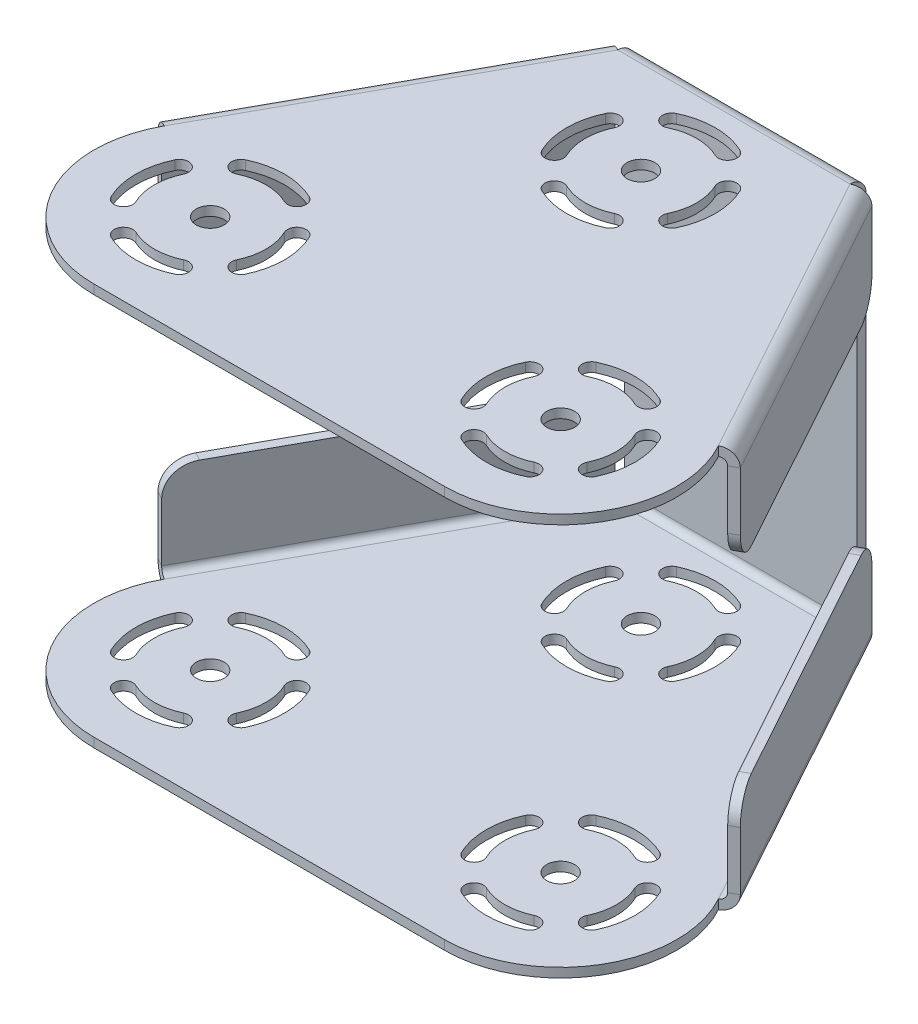
from build123d import *

# Parameters (mm, degrees)
SM_BASE_FLANGE_1_DEPTH        = 1
SM_EDGE_FLANGE_1_DEPTH        = 25
SM_EDGE_FLANGE_2_DEPTH        = 25
SM_START                      = 1
SM_EDGE_FLANGE_2_FLAT_DEPTH   = 1
SKETCH_6_R                    = 1.5
CUT_EXTRUDE_1_DEPTH           = 79.396934628
FILLET_1_R                    = 12.5
SM_EDGE_FLANGE_3_DEPTH        = 35.922670789
SM_EDGE_FLANGE_3_BEND_DEPTH   = 35.922670789
SM_EDGE_FLANGE_3_BEND_2_DEPTH = 35.922670789
SM_EDGE_FLANGE_3_BEND_3_DEPTH = 35.922670789
FILLET_2_R                    = 3
SKETCH_36_R                   = 1.5
CUT_EXTRUDE_2_DEPTH           = 75.360427128


# Sheet-metal steps are written as plain solids
with BuildPart() as part:
    # Sketch 1 → 基材-凸緣1 (new body)
    with BuildSketch(Plane(origin=(0, 0, 0), x_dir=(1, 0, 0), z_dir=(0, 1, 0))):
        Polygon((-12.5, 50), (-40, 0), (40, 0), (12.5, 50), align=None)
    extrude(amount=-SM_BASE_FLANGE_1_DEPTH)

    # 邊線-凸緣1 section (across the edge) → 邊線-凸緣1 (add)
    with BuildSketch(Plane(origin=(-12.5, -1, -50.7366), x_dir=(0, 0, 1), z_dir=(1, 0, 0))):
        with BuildLine():
            Line((-1, 0.7366), (-1, 40.5))
            Line((-1, 40.5), (0, 40.5))
            Line((0, 40.5), (0, 0.7366))
            ThreePointArc((0, 0.7366), (0.215745145, 0.215745145), (0.7366, 0))
            Line((0.7366, 0), (0.7366, -1))
            ThreePointArc((0.7366, -1), (-0.491361636, -0.491361636), (-1, 0.7366))
        make_face()
    extrude(amount=SM_EDGE_FLANGE_1_DEPTH)

    # 邊線-凸緣2 bend section (across the edge) → 邊線-凸緣2 (add)
    with BuildSketch(Plane(origin=(-12.5, -42.2366, -50.7366), x_dir=(0, 1, 0), z_dir=(1, 0, 0))):
        with BuildLine():
            Line((-1, 0.7366), (0, 0.7366))
            ThreePointArc((0, 0.7366), (0.215745145, 0.215745145), (0.7366, 0))
            Line((0.7366, 0), (0.7366, -1))
            ThreePointArc((0.7366, -1), (-0.491361636, -0.491361636), (-1, 0.7366))
        make_face()
    extrude(amount=SM_EDGE_FLANGE_2_DEPTH)

    # 邊線-凸緣2 profile (on flange) → 邊線-凸緣2 flat (add)
    with BuildSketch(Plane(origin=(0, -42.2366, -50.7366), x_dir=(1, 0, 0), z_dir=(0, -1, 0)).offset(SM_START)):
        Polygon((12.5, 0.7366), (40, 50.7366), (-40, 50.7366), (-12.5, 0.7366), align=None)
    extrude(amount=-SM_EDGE_FLANGE_2_FLAT_DEPTH)

    # Sketch 6 → 除料-伸長1 (cut, through all)
    with BuildSketch(Plane(origin=(0, 0, 0), x_dir=(1, 0, 0), z_dir=(0, 1, 0))):
        with Locations(Location((0, 40, 0), (0, 0, 270))):
            Circle(SKETCH_6_R)
        with BuildLine():
            ThreePointArc((3.428571429, 47.228063223), (0, 48), (-3.428571429, 47.228063223))
            ThreePointArc((-3.428571429, 47.228063223), (-3.903507903, 45.895983892), (-2.571428571, 45.421047417))
            ThreePointArc((-2.571428571, 45.421047417), (0, 46), (2.571428571, 45.421047417))
            ThreePointArc((2.571428571, 45.421047417), (3.903507903, 45.895983892), (3.428571429, 47.228063223))
        make_face()
        with BuildLine():
            ThreePointArc((-5.421047417, 42.571428571), (-6, 40), (-5.421047417, 37.428571429))
            ThreePointArc((-5.421047417, 37.428571429), (-5.895983892, 36.096492097), (-7.228063223, 36.571428571))
            ThreePointArc((-7.228063223, 36.571428571), (-8, 40), (-7.228063223, 43.428571429))
            ThreePointArc((-7.228063223, 43.428571429), (-5.895983892, 43.903507903), (-5.421047417, 42.571428571))
        make_face()
        with BuildLine():
            ThreePointArc((-2.571428571, 34.578952583), (0, 34), (2.571428571, 34.578952583))
            ThreePointArc((2.571428571, 34.578952583), (3.903507903, 34.104016108), (3.428571429, 32.771936777))
            ThreePointArc((3.428571429, 32.771936777), (0, 32), (-3.428571429, 32.771936777))
            ThreePointArc((-3.428571429, 32.771936777), (-3.903507903, 34.104016108), (-2.571428571, 34.578952583))
        make_face()
        with BuildLine():
            ThreePointArc((5.421047417, 37.428571429), (6, 40), (5.421047417, 42.571428571))
            ThreePointArc((5.421047417, 42.571428571), (5.895983892, 43.903507903), (7.228063223, 43.428571429))
            ThreePointArc((7.228063223, 43.428571429), (8, 40), (7.228063223, 36.571428571))
            ThreePointArc((7.228063223, 36.571428571), (5.895983892, 36.096492097), (5.421047417, 37.428571429))
        make_face()
    extrude(amount=-CUT_EXTRUDE_1_DEPTH, mode=Mode.SUBTRACT)

    # 圓角1
    fillet_1_edges = [part.edges().sort_by_distance(p)[0] for p in [
        (40, -42.7366, 0),
        (-40, -42.7366, 0),
        (40, -0.5, 0),
        (-40, -0.5, 0),
    ]]
    fillet(fillet_1_edges, radius=FILLET_1_R)

    # 邊線-凸緣3 section (across the edge) → 邊線-凸緣3 (add)
    with BuildSketch(Plane(origin=(-13.145420638, -42.2366, -50.354981351), x_dir=(0.8762159086766461, -1.0482730393447964e-15, 0.48191874977215743), z_dir=(-0.48191874977215743, -8.305964765733612e-15, 0.8762159086766461))):
        with BuildLine():
            Line((-1, 0.7366), (-1, 10))
            Line((-1, 10), (0, 10))
            Line((0, 10), (0, 0.7366))
            ThreePointArc((0, 0.7366), (0.215745145, 0.215745145), (0.7366, 0))
            Line((0.7366, 0), (0.7366, -1))
            ThreePointArc((0.7366, -1), (-0.491361636, -0.491361636), (-1, 0.7366))
        make_face()
    extrude(amount=SM_EDGE_FLANGE_3_DEPTH)

    # 邊線-凸緣3 section 2 (across the edge) → 邊線-凸緣3 bend (add)
    with BuildSketch(Plane(origin=(-30.457229234, -1, -18.878965723), x_dir=(0.8762159086766471, -3.491481338843133e-15, 0.4819187497721558), z_dir=(0.4819187497721558, 0, -0.8762159086766471))):
        with BuildLine():
            Line((-1, 0.7366), (-1, 10))
            Line((-1, 10), (0, 10))
            Line((0, 10), (0, 0.7366))
            ThreePointArc((0, 0.7366), (0.215745145, 0.215745145), (0.7366, 0))
            Line((0.7366, 0), (0.7366, -1))
            ThreePointArc((0.7366, -1), (-0.491361636, -0.491361636), (-1, 0.7366))
        make_face()
    extrude(amount=SM_EDGE_FLANGE_3_BEND_DEPTH)

    # 邊線-凸緣3 section 3 (across the edge) → 邊線-凸緣3 bend 2 (add)
    with BuildSketch(Plane(origin=(13.145420638, -1, -50.354981351), x_dir=(-0.8762159086766472, -3.4914813388431337e-15, 0.48191874977215576), z_dir=(0.48191874977215576, 0, 0.8762159086766472))):
        with BuildLine():
            Line((-1, 0.7366), (-1, 10))
            Line((-1, 10), (0, 10))
            Line((0, 10), (0, 0.7366))
            ThreePointArc((0, 0.7366), (0.215745145, 0.215745145), (0.7366, 0))
            Line((0.7366, 0), (0.7366, -1))
            ThreePointArc((0.7366, -1), (-0.491361636, -0.491361636), (-1, 0.7366))
        make_face()
    extrude(amount=SM_EDGE_FLANGE_3_BEND_2_DEPTH)

    # 邊線-凸緣3 section 4 (across the edge) → 邊線-凸緣3 bend 3 (add)
    with BuildSketch(Plane(origin=(30.457229234, -42.2366, -18.878965723), x_dir=(-0.8762159086766471, -1.0482730393447789e-15, 0.4819187497721558), z_dir=(-0.4819187497721558, 8.305964765733621e-15, -0.8762159086766471))):
        with BuildLine():
            Line((-1, 0.7366), (-1, 10))
            Line((-1, 10), (0, 10))
            Line((0, 10), (0, 0.7366))
            ThreePointArc((0, 0.7366), (0.215745145, 0.215745145), (0.7366, 0))
            Line((0.7366, 0), (0.7366, -1))
            ThreePointArc((0.7366, -1), (-0.491361636, -0.491361636), (-1, 0.7366))
        make_face()
    extrude(amount=SM_EDGE_FLANGE_3_BEND_3_DEPTH)

    # 圓角2
    fillet_2_edges = [part.edges().sort_by_distance(p)[0] for p in [
        (-13.583528593, -32.2366, -50.595940726),
        (-30.895337188, -32.2366, -19.119925098),
        (-30.895337188, -11, -19.119925098),
        (-13.583528593, -11, -50.595940726),
        (13.583528593, -11, -50.595940726),
        (30.895337188, -11, -19.119925098),
        (30.895337188, -32.2366, -19.119925098),
        (13.583528593, -32.2366, -50.595940726),
    ]]
    fillet(fillet_2_edges, radius=FILLET_2_R)

    # 草圖36 → 除料-伸長2 (cut, through all)
    with BuildSketch(Plane(origin=(0, 0, 0), x_dir=(1, 0, 0), z_dir=(0, 1, 0))):
        with Locations(Location((-18.859109737, 12.5, 0), (0, 0, 270))):
            Circle(SKETCH_36_R)
        with BuildLine():
            ThreePointArc((-15.430538308, 19.728063223), (-18.859109737, 20.5), (-22.287681165, 19.728063223))
            ThreePointArc((-22.287681165, 19.728063223), (-22.76261764, 18.395983892), (-21.430538308, 17.921047417))
            ThreePointArc((-21.430538308, 17.921047417), (-18.859109737, 18.5), (-16.287681165, 17.921047417))
            ThreePointArc((-16.287681165, 17.921047417), (-14.955601834, 18.395983892), (-15.430538308, 19.728063223))
        make_face()
        with BuildLine():
            ThreePointArc((-24.280157154, 15.071428571), (-24.859109737, 12.5), (-24.280157154, 9.928571429))
            ThreePointArc((-24.280157154, 9.928571429), (-24.755093629, 8.596492097), (-26.08717296, 9.071428571))
            ThreePointArc((-26.08717296, 9.071428571), (-26.859109737, 12.5), (-26.08717296, 15.928571429))
            ThreePointArc((-26.08717296, 15.928571429), (-24.755093629, 16.403507903), (-24.280157154, 15.071428571))
        make_face()
        with BuildLine():
            ThreePointArc((-21.430538308, 7.078952583), (-18.859109737, 6.5), (-16.287681165, 7.078952583))
            ThreePointArc((-16.287681165, 7.078952583), (-14.955601834, 6.604016108), (-15.430538308, 5.271936777))
            ThreePointArc((-15.430538308, 5.271936777), (-18.859109737, 4.5), (-22.287681165, 5.271936777))
            ThreePointArc((-22.287681165, 5.271936777), (-22.76261764, 6.604016108), (-21.430538308, 7.078952583))
        make_face()
        with BuildLine():
            ThreePointArc((-13.438062319, 9.928571429), (-12.859109737, 12.5), (-13.438062319, 15.071428571))
            ThreePointArc((-13.438062319, 15.071428571), (-12.963125845, 16.403507903), (-11.631046514, 15.928571429))
            ThreePointArc((-11.631046514, 15.928571429), (-10.859109737, 12.5), (-11.631046514, 9.071428571))
            ThreePointArc((-11.631046514, 9.071428571), (-12.963125845, 8.596492097), (-13.438062319, 9.928571429))
        make_face()
    cut_extrude_2 = extrude(amount=-CUT_EXTRUDE_2_DEPTH, mode=Mode.SUBTRACT)

    # 鏡射1: 除料-伸長2 across plane
    add(cut_extrude_2.mirror(Plane(origin=(0, 0, 0), x_dir=(0, 0, 1), z_dir=(1, 0, 0))), mode=Mode.SUBTRACT)


solid = part.part
